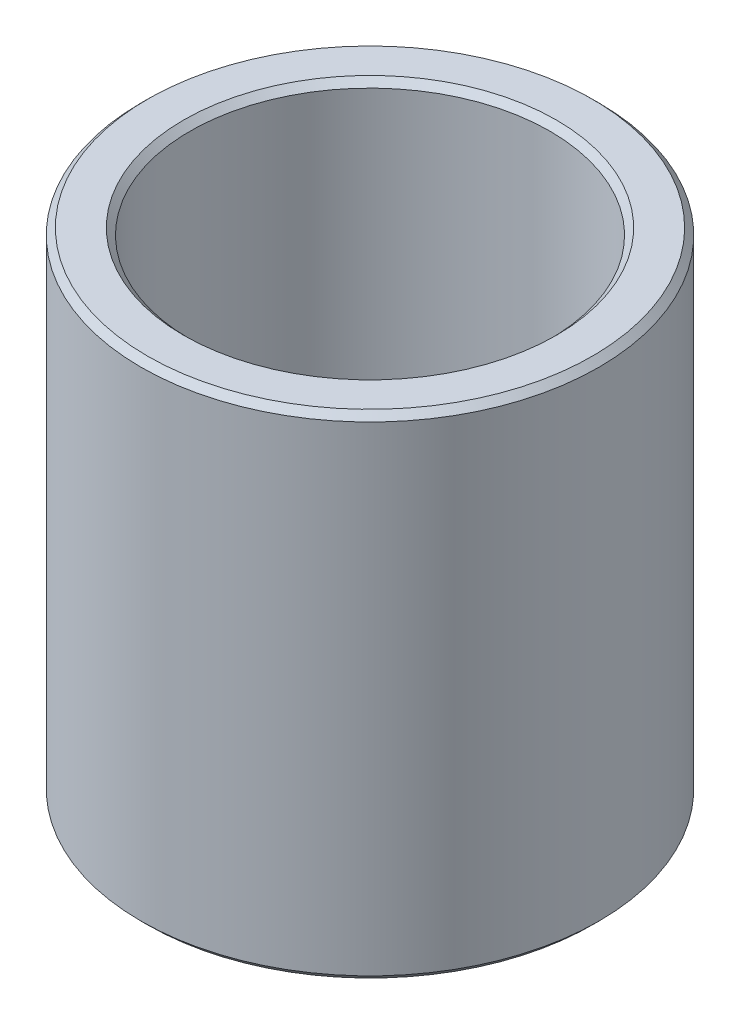
from build123d import *

# Parameters (mm, degrees)
SKETCH1_R           = 42.5
BOSS_EXTRUDE1_DEPTH = 91.436440187
SKETCH2_R           = 33.418647183
CUT_EXTRUDE1_DEPTH  = 110.421764718
CHAMFER1_SIZE       = 1.194486636


with BuildPart() as part:
    # Sketch1 → Boss-Extrude1 (new body)
    with BuildSketch(Plane(origin=(0, 0, 0), x_dir=(1, 0, 0), z_dir=(0, 1, 0))):
        Circle(SKETCH1_R)
    extrude(amount=BOSS_EXTRUDE1_DEPTH)

    # Sketch2 → Cut-Extrude1 (cut, through all)
    with BuildSketch(Plane(origin=(0, 0, 0), x_dir=(1, 0, 0), z_dir=(0, 1, 0))):
        Circle(SKETCH2_R)
    extrude(amount=CUT_EXTRUDE1_DEPTH, mode=Mode.SUBTRACT)

    # Chamfer1
    chamfer1_edges = [part.edges().sort_by_distance(p)[0] for p in [
        (-33.418647183, 91.436440187, 0),
        (-33.418647183, 0, 0),
        (-42.5, 0, 0),
        (-42.5, 91.436440187, 0),
    ]]
    chamfer(chamfer1_edges, length=CHAMFER1_SIZE)


solid = part.part
